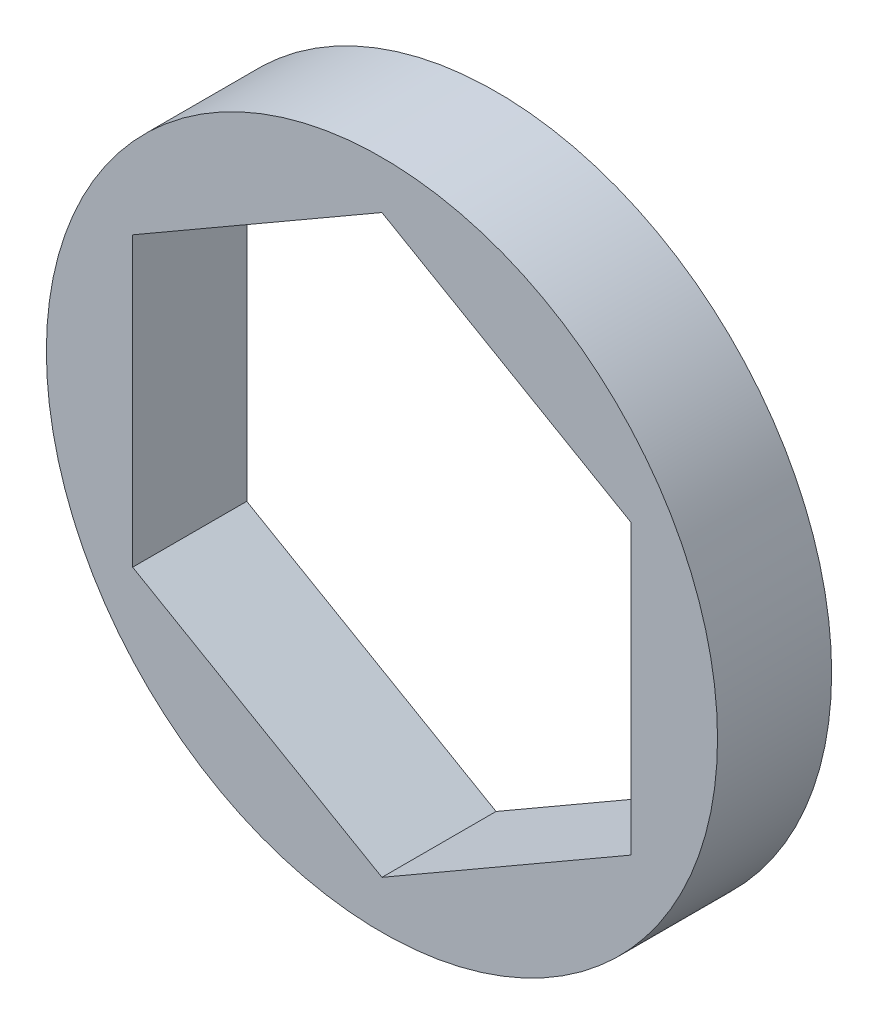
from build123d import *

# Parameters (mm, degrees)
SKETCH1_R           = 8.89
BOSS_EXTRUDE1_DEPTH = 3.0226


with BuildPart() as part:
    # Sketch1 → Boss-Extrude1 (new body)
    with BuildSketch(Plane.XY):
        Circle(SKETCH1_R)
        Polygon((6.604, 3.812821178), (0, 7.625642355), (-6.604, 3.812821178), (-6.604, -3.812821178), (0, -7.625642355), (6.604, -3.812821178), align=None, mode=Mode.SUBTRACT)
    extrude(amount=BOSS_EXTRUDE1_DEPTH)


solid = part.part
